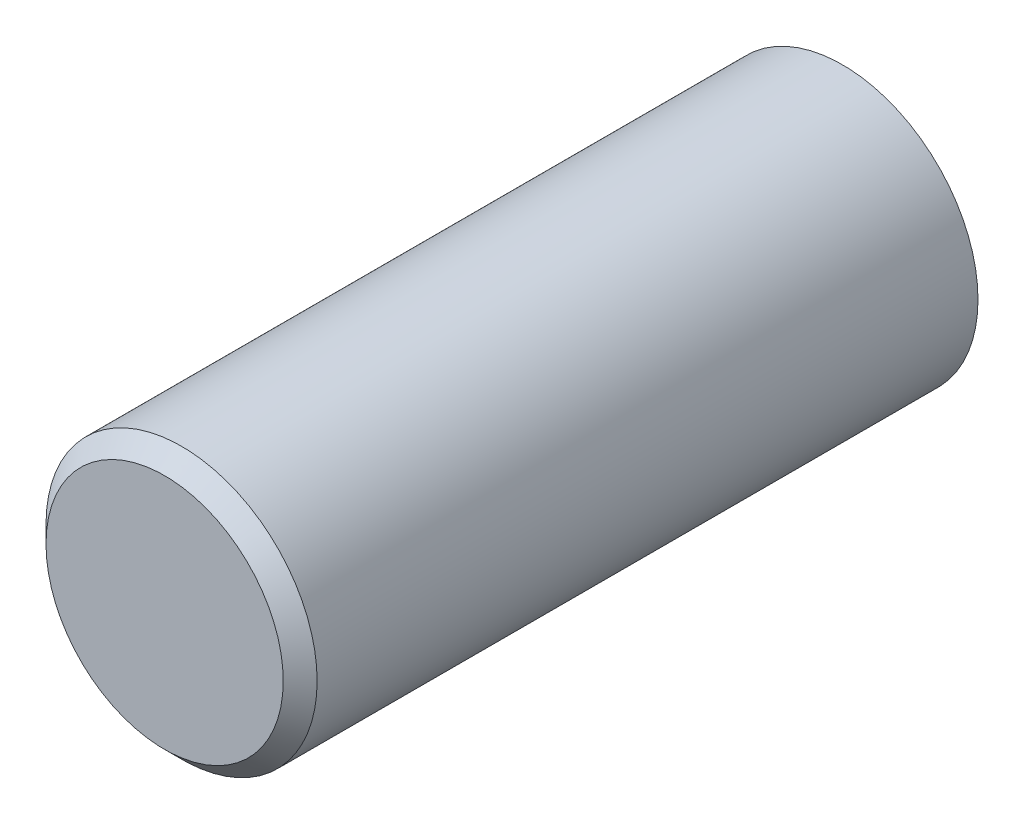
from build123d import *

# Parameters (mm, degrees)
ESQUISSE1_R        = 4
BOSS_EXTRU_1_DEPTH = 20
CHANFREIN1_SIZE    = 0.5


with BuildPart() as part:
    # Esquisse1 → Boss.-Extru.1 (new body)
    with BuildSketch(Plane.XY):
        Circle(ESQUISSE1_R)
    extrude(amount=BOSS_EXTRU_1_DEPTH)

    # Chanfrein1
    chanfrein1_edges = [part.edges().sort_by_distance(p)[0] for p in [
        (-4, 0, 20),
    ]]
    chamfer(chanfrein1_edges, length=CHANFREIN1_SIZE)


solid = part.part
